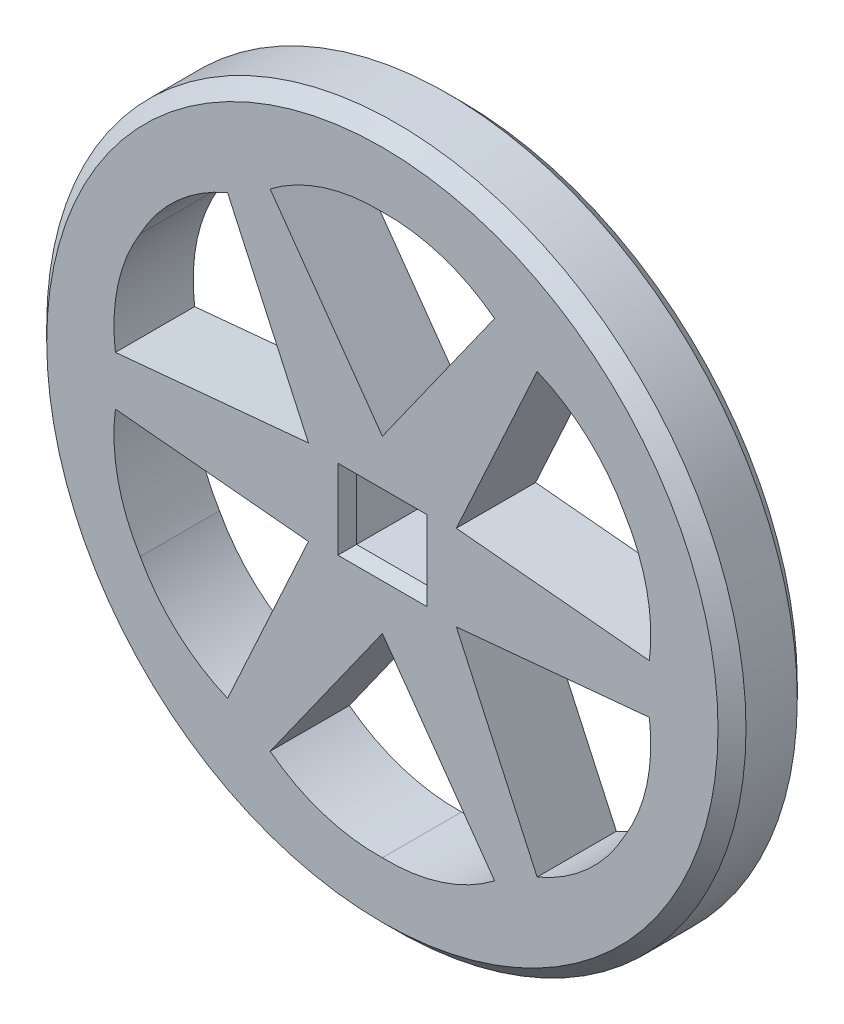
from build123d import *

# Parameters (mm, degrees)
SKETCH1_R           = 37.5
SKETCH1_W           = 8.55
SKETCH1_H           = 7.55
BOSS_EXTRUDE1_DEPTH = 4.25
CUT_EXTRUDE1_DEPTH  = 54.203030929
CIRPATTERN1_COUNT   = 6
CHAMFER1_SIZE       = 0.5
CHAMFER1_SIZE2      = 1.5
CHAMFER2_SIZE       = 1.5


with BuildPart() as part:
    # Sketch1 → Boss-Extrude1 (new, symmetric)
    with BuildSketch(Plane.XY):
        Circle(SKETCH1_R)
        Rectangle(SKETCH1_W, SKETCH1_H, mode=Mode.SUBTRACT)
    extrude(amount=BOSS_EXTRUDE1_DEPTH, both=True)

    # Sketch2 → Cut-Extrude1 (cut, symmetric)
    with BuildSketch(Plane.XY):
        with BuildLine():
            Line((0, 9.158641407), (-12.037071564, 26.115211784))
            ThreePointArc((-12.037071564, 26.115211784), (-6.351662121, 29.087034336), (0, 29.988143709))
            ThreePointArc((0, 29.988143709), (6.351662121, 29.087034336), (12.037071564, 26.115211784))
            Line((12.037071564, 26.115211784), (0, 9.158641407))
        make_face()
    cut_extrude1 = extrude(amount=CUT_EXTRUDE1_DEPTH, both=True, mode=Mode.SUBTRACT)

    # CirPattern1: Cut-Extrude1 ×6 about axis
    cirpattern1_axis = Axis((0, 0, 4.25), (0, 0, -1))
    for i in range(1, CIRPATTERN1_COUNT):
        add(cut_extrude1.rotate(cirpattern1_axis, i * 360 / CIRPATTERN1_COUNT), mode=Mode.SUBTRACT)

    # Chamfer1
    chamfer1_edges = [part.edges().sort_by_distance(p)[0] for p in [
        (4.275, 0, 4.25),
        (0, 3.775, 4.25),
        (-4.275, 0, 4.25),
        (0, -3.775, 4.25),
    ]]
    chamfer1_side = [part.faces().sort_by_distance(p)[0] for p in [
        (-36.439339828, 0, 4.25),
    ]]
    chamfer(chamfer1_edges, length=CHAMFER1_SIZE, length2=CHAMFER1_SIZE2, reference=chamfer1_side[0])

    # Chamfer2
    chamfer2_edges = [part.edges().sort_by_distance(p)[0] for p in [
        (-37.5, 0, 4.25),
        (-37.5, 0, -4.25),
    ]]
    chamfer(chamfer2_edges, length=CHAMFER2_SIZE)


solid = part.part
